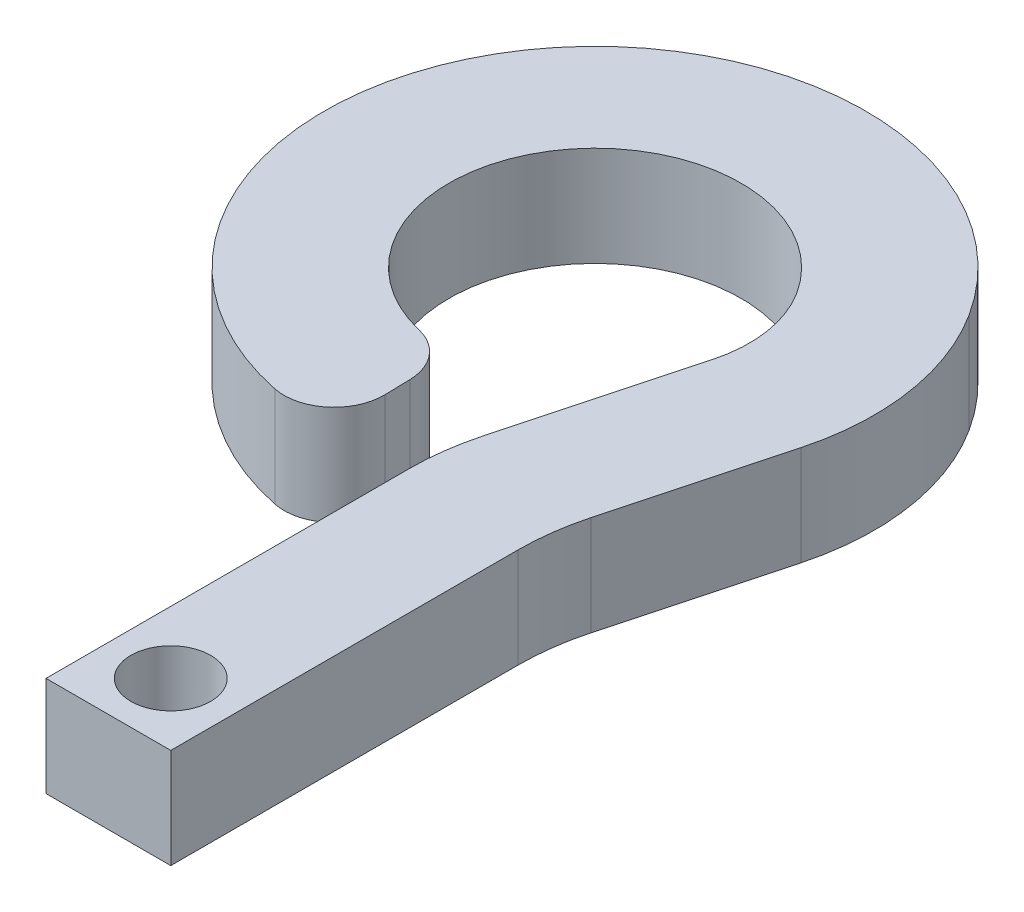
from build123d import *

# Parameters (mm, degrees)
BASE_FLANGE1_DEPTH = 4
FILLET1_R          = 2
FILLET2_R          = 5
FILLET3_R          = 10
SKETCH6_R          = 1.6
CUT_EXTRUDE1_DEPTH = 10


# Sheet-metal steps are written as plain solids
with BuildPart() as part:
    # Sketch1 → Base-Flange1 (new body)
    with BuildSketch(Plane(origin=(0, 0, 0), x_dir=(1, 0, 0), z_dir=(0, 1, 0))):
        with BuildLine():
            Line((0, 0), (-5, 0))
            Line((-5, 0), (-5, 14.567226763))
            ThreePointArc((-5, 14.567226763), (-4.914448614, 15.872488686), (-4.659258263, 17.155417214))
            Line((-4.659258263, 17.155417214), (-2.411809549, 25.543010002))
            ThreePointArc((-2.411809549, 25.543010002), (-12.545541462, 29.253521737), (-8.119779436, 19.41111094))
            Line((-8.119779436, 19.41111094), (-8, 14.412545857))
            ThreePointArc((-8, 14.412545857), (-15.893198966, 32.982001696), (2.588190451, 24.884747514))
            Line((2.588190451, 24.884747514), (0.340741737, 16.497154727))
            ThreePointArc((0.340741737, 16.497154727), (0.085551386, 15.214226198), (0, 13.908964276))
            Line((0, 13.908964276), (0, 0))
        make_face()
    extrude(amount=-BASE_FLANGE1_DEPTH)

    # Fillet1
    fillet1_edges = [part.edges().sort_by_distance(p)[0] for p in [
        (-8.119779436, -2, -19.41111094),
        (-8, -2, -14.412545857),
    ]]
    fillet(fillet1_edges, radius=FILLET1_R)

    # Fillet2
    fillet2_edges = [part.edges().sort_by_distance(p)[0] for p in [
        (-2.411809549, -2, -25.543010002),
    ]]
    fillet(fillet2_edges, radius=FILLET2_R)

    # Fillet3
    fillet3_edges = [part.edges().sort_by_distance(p)[0] for p in [
        (2.588190451, -2, -24.884747514),
    ]]
    fillet(fillet3_edges, radius=FILLET3_R)

    # Sketch6 → Cut-Extrude1 (cut)
    with BuildSketch(Plane(origin=(0, 0, 0), x_dir=(1, 0, 0), z_dir=(0, 1, 0))):
        with Locations(Location((-2.5, 2.5, 0), (0, 0, 270))):
            Circle(SKETCH6_R)
    extrude(amount=-CUT_EXTRUDE1_DEPTH, mode=Mode.SUBTRACT)


solid = part.part
